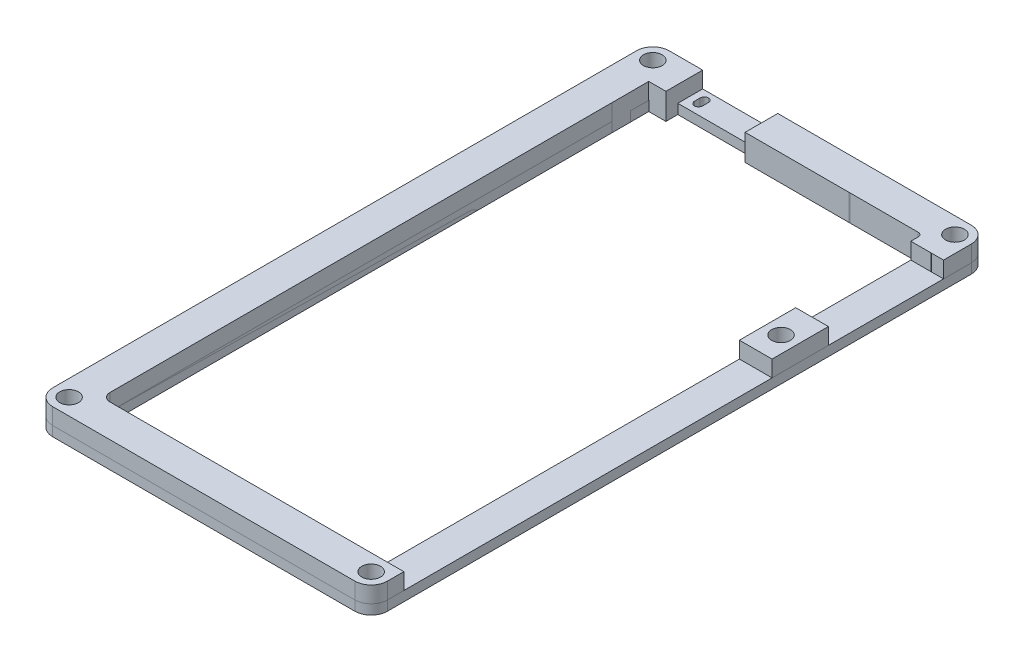
from build123d import *

# Parameters (mm, degrees)
A_MODIFY_R     = 1.15
TOP_A_DEPTH    = 3.2
TOP_A_2_DEPTH  = 3.2
TOP_A_3_DEPTH  = 3.2
C_MODIFY_R     = 1.15
C_MODIFY_W     = 32.999664857
C_MODIFY_H     = 68.457402291
BOTTOM_C_DEPTH = 1.2


with BuildPart() as part:
    # A-modify → top-A (new body)
    with BuildSketch(Plane(origin=(0, 0, 0), x_dir=(1, 0, 0), z_dir=(0, 1, 0))):
        with BuildLine():
            Line((0, 1.0025), (0, 62.4975))
            ThreePointArc((0, 62.4975), (-0.001767767, 62.501767767), (0.0025, 62.5))
            Line((0.0025, 62.5), (-0.0025, 67))
            Line((-0.0025, 67), (2.0975, 67))
            ThreePointArc((2.0975, 67), (2.098232233, 67.001767767), (2.1, 67.0025))
            Line((2.1, 67.0025), (2.1, 71.5))
            Line((2.1, 71.5), (-1.9975, 71.5))
            ThreePointArc((-1.9975, 71.5), (-1.998232233, 71.498232233), (-2, 71.4975))
            ThreePointArc((-2, 71.4975), (-2.001767194, 71.49823166), (-2.002499999, 71.49999838))
            ThreePointArc((-2.002499999, 71.49999838), (-3.4142, 70.9142), (-3.99999838, 69.502499999))
            ThreePointArc((-3.99999838, 69.502499999), (-3.9975, 69.49999919), (-4, 69.4975))
            Line((-4, 69.4975), (-4, -1.9975))
            ThreePointArc((-4, -1.9975), (-3.9975, -1.99999919), (-3.99999838, -2.002499999))
            ThreePointArc((-3.99999838, -2.002499999), (-3.4142, -3.4142), (-2.002499999, -3.99999838))
            ThreePointArc((-2.002499999, -3.99999838), (-1.99999919, -3.9975), (-1.9975, -4))
            Line((-1.9975, -4), (34.9975, -4))
            ThreePointArc((34.9975, -4), (34.99999919, -3.9975), (35.002499999, -3.99999838))
            ThreePointArc((35.002499999, -3.99999838), (36.4142, -3.4142), (36.99999838, -2.002499999))
            ThreePointArc((36.99999838, -2.002499999), (36.99823166, -2.001767194), (36.9975, -2))
            ThreePointArc((36.9975, -2), (36.998232233, -1.998232233), (37, -1.9975))
            Line((37, -1.9975), (37, 0))
            Line((37, 0), (1.0025, 0))
            ThreePointArc((1.0025, 0), (0.999998409, -0.002499999), (0.997500002, 3.183e-06))
            ThreePointArc((0.997500002, 3.183e-06), (0.2929, 0.2929), (3.183e-06, 0.997500002))
            ThreePointArc((3.183e-06, 0.997500002), (-0.002499999, 0.999998409), (0, 1.0025))
        make_face()
        with Locations((-2, -2)):
            Circle(A_MODIFY_R, mode=Mode.SUBTRACT)
        with Locations((35, -2)):
            Circle(A_MODIFY_R, mode=Mode.SUBTRACT)
        with Locations((-2, 69.5)):
            Circle(A_MODIFY_R, mode=Mode.SUBTRACT)
    extrude(amount=TOP_A_DEPTH)


with BuildPart() as body_2:
    # A-modify → top-A 2 (new body)
    with BuildSketch(Plane(origin=(0, 0, 0), x_dir=(1, 0, 0), z_dir=(0, 1, 0))):
        with BuildLine():
            Line((32.999990591, 66.9975), (32.999999984, 66.102483207))
            ThreePointArc((32.999999984, 66.102483207), (33.002500011, 66.09998322), (33.000000011, 66.097483207))
            Line((33.000000011, 66.097483207), (35.5, 66.0975))
            ThreePointArc((35.5, 66.0975), (35.498233345, 66.101768878), (35.502499998, 66.099996857))
            Line((35.502499996, 66.099996857), (37, 66.1))
            Line((37, 66.1), (37, 69.4975))
            ThreePointArc((37, 69.4975), (36.9975, 69.49999919), (36.99999838, 69.502499999))
            ThreePointArc((36.99999838, 69.502499999), (36.4142, 70.9142), (35.002499999, 71.49999838))
            ThreePointArc((35.002499999, 71.49999838), (34.99999919, 71.4975), (34.9975, 71.5))
            Line((34.9975, 71.5), (11.3, 71.5))
            Line((11.3, 71.5), (11.3, 67.4975))
            Line((11.3, 67.4975), (24.02849934, 67.4975))
            ThreePointArc((24.02849934, 67.4975), (24.077184455, 67.499342357), (24.125900001, 67.499998349))
            ThreePointArc((24.125900001, 67.499998349), (24.128399175, 67.5025), (24.1309, 67.5))
            Line((24.1309, 67.5), (32.4975, 67.5))
            ThreePointArc((32.4975, 67.5), (32.500003177, 67.502499998), (32.502499992, 67.499993645))
            ThreePointArc((32.502499992, 67.499993645), (32.853543901, 67.353546664), (32.999984257, 67.002499992))
            ThreePointArc((32.999984257, 67.002499992), (33.002490563, 67.000003167), (32.999990591, 66.9975))
        make_face()
        with Locations((35, 69.5)):
            Circle(A_MODIFY_R, mode=Mode.SUBTRACT)
    extrude(amount=TOP_A_2_DEPTH)


with BuildPart() as body_3:
    # A-modify → top-A 3 (new body)
    with BuildSketch(Plane(origin=(0, 0, 0), x_dir=(1, 0, 0), z_dir=(0, 1, 0))):
        with BuildLine():
            Line((37, 52), (35.502499996, 52.000003143))
            ThreePointArc((35.502499998, 52.000003143), (35.501768878, 51.998233345), (35.5, 51.9975))
            Line((35.5, 51.9975), (33, 51.997516793))
            Line((33, 51.997516793), (32.999953663, 45.100016793))
            Line((32.999953663, 45.100016793), (33.002453663, 45.100016776))
            Line((33.002453663, 45.100016793), (37, 45.099989924))
            Line((37, 45.099989924), (37, 52))
        make_face()
        with Locations((35, 48.2)):
            Circle(A_MODIFY_R, mode=Mode.SUBTRACT)
    extrude(amount=TOP_A_3_DEPTH)


with BuildPart() as body_4:
    # c-modify → bottom-C (new body)
    with BuildSketch(Plane(origin=(0, 0, 0), x_dir=(1, 0, 0), z_dir=(0, 1, 0))):
        with BuildLine():
            Line((-4, 69.4975), (-4, -1.9975))
            ThreePointArc((-4, -1.9975), (-3.998232233, -1.998232233), (-3.9975, -2))
            ThreePointArc((-3.9975, -2), (-3.99823166, -2.001767194), (-3.99999838, -2.002499999))
            ThreePointArc((-3.99999838, -2.002499999), (-3.4142, -3.4142), (-2.002499999, -3.99999838))
            ThreePointArc((-2.002499999, -3.99999838), (-2.001767194, -3.99823166), (-2, -3.9975))
            ThreePointArc((-2, -3.9975), (-1.998232233, -3.998232233), (-1.9975, -4))
            Line((-1.9975, -4), (34.9975, -4))
            ThreePointArc((34.9975, -4), (34.998232233, -3.998232233), (35, -3.9975))
            ThreePointArc((35, -3.9975), (35.001767194, -3.99823166), (35.002499999, -3.99999838))
            ThreePointArc((35.002499999, -3.99999838), (36.4142, -3.4142), (36.99999838, -2.002499999))
            ThreePointArc((36.99999838, -2.002499999), (36.99823166, -2.001767194), (36.9975, -2))
            ThreePointArc((36.9975, -2), (36.998232233, -1.998232233), (37, -1.9975))
            Line((37, -1.9975), (37, 69.4975))
            ThreePointArc((37, 69.4975), (36.998232233, 69.498232233), (36.9975, 69.5))
            ThreePointArc((36.9975, 69.5), (36.99823166, 69.501767194), (36.99999838, 69.502499999))
            ThreePointArc((36.99999838, 69.502499999), (36.4142, 70.9142), (35.002499999, 71.49999838))
            ThreePointArc((35.002499999, 71.49999838), (35.001767194, 71.49823166), (35, 71.4975))
            ThreePointArc((35, 71.4975), (34.998232233, 71.498232233), (34.9975, 71.5))
            Line((34.9975, 71.5), (-1.9975, 71.5))
            ThreePointArc((-1.9975, 71.5), (-1.998232233, 71.498232233), (-2, 71.4975))
            ThreePointArc((-2, 71.4975), (-2.001767194, 71.49823166), (-2.002499999, 71.49999838))
            ThreePointArc((-2.002499999, 71.49999838), (-3.4142, 70.9142), (-3.99999838, 69.502499999))
            ThreePointArc((-3.99999838, 69.502499999), (-3.99823166, 69.501767194), (-3.9975, 69.5))
            ThreePointArc((-3.9975, 69.5), (-3.998232233, 69.498232233), (-4, 69.4975))
        make_face()
        with Locations((-2, -2)):
            Circle(C_MODIFY_R, mode=Mode.SUBTRACT)
        with Locations((35, -2)):
            Circle(C_MODIFY_R, mode=Mode.SUBTRACT)
        with Locations((16.499832428, 34.228701146)):
            Rectangle(C_MODIFY_W, C_MODIFY_H, mode=Mode.SUBTRACT)
        with Locations((-2, 69.5)):
            Circle(C_MODIFY_R, mode=Mode.SUBTRACT)
        with BuildLine():
            ThreePointArc((2.8975, 69.7), (2.898232233, 69.701767767), (2.9, 69.7025))
            Line((2.9, 69.7025), (2.9, 70.3975))
            ThreePointArc((2.9, 70.3975), (2.898232233, 70.398232233), (2.8975, 70.4))
            ThreePointArc((2.8975, 70.4), (2.898234465, 70.401769996), (2.900006308, 70.402499992))
            ThreePointArc((2.900006308, 70.402499992), (3.04645, 70.75355), (3.397500008, 70.899993692))
            ThreePointArc((3.397500008, 70.899993692), (3.398230004, 70.901765535), (3.4, 70.9025))
            ThreePointArc((3.4, 70.9025), (3.401769996, 70.901765535), (3.402499992, 70.899993692))
            ThreePointArc((3.402499992, 70.899993692), (3.75355, 70.75355), (3.899993692, 70.402499992))
            ThreePointArc((3.899993692, 70.402499992), (3.901765535, 70.401769996), (3.9025, 70.4))
            ThreePointArc((3.9025, 70.4), (3.901767767, 70.398232233), (3.9, 70.3975))
            Line((3.9, 70.3975), (3.9, 69.7025))
            ThreePointArc((3.9, 69.7025), (3.901767767, 69.701767767), (3.9025, 69.7))
            ThreePointArc((3.9025, 69.7), (3.901765535, 69.698230004), (3.899993692, 69.697500008))
            ThreePointArc((3.899993692, 69.697500008), (3.75355, 69.34645), (3.402499992, 69.200006308))
            ThreePointArc((3.402499992, 69.200006308), (3.401769996, 69.198234465), (3.4, 69.1975))
            ThreePointArc((3.4, 69.1975), (3.398230004, 69.198234465), (3.397500008, 69.200006308))
            ThreePointArc((3.397500008, 69.200006308), (3.04645, 69.34645), (2.900006308, 69.697500008))
            ThreePointArc((2.900006308, 69.697500008), (2.898234465, 69.698230004), (2.8975, 69.7))
        make_face(mode=Mode.SUBTRACT)
        with BuildLine():
            ThreePointArc((9.4975, 69.7), (9.498232233, 69.701767767), (9.5, 69.7025))
            Line((9.5, 69.7025), (9.5, 70.3975))
            ThreePointArc((9.5, 70.3975), (9.498232233, 70.398232233), (9.4975, 70.4))
            ThreePointArc((9.4975, 70.4), (9.498234465, 70.401769996), (9.500006308, 70.402499992))
            ThreePointArc((9.500006308, 70.402499992), (9.64645, 70.75355), (9.997500008, 70.899993692))
            ThreePointArc((9.997500008, 70.899993692), (9.998230004, 70.901765535), (10, 70.9025))
            ThreePointArc((10, 70.9025), (10.001769996, 70.901765535), (10.002499992, 70.899993692))
            ThreePointArc((10.002499992, 70.899993692), (10.35355, 70.75355), (10.499993692, 70.402499992))
            ThreePointArc((10.499993692, 70.402499992), (10.501765535, 70.401769996), (10.5025, 70.4))
            ThreePointArc((10.5025, 70.4), (10.501767767, 70.398232233), (10.5, 70.3975))
            Line((10.5, 70.3975), (10.5, 69.7025))
            ThreePointArc((10.5, 69.7025), (10.501767767, 69.701767767), (10.5025, 69.7))
            ThreePointArc((10.5025, 69.7), (10.501765535, 69.698230004), (10.499993692, 69.697500008))
            ThreePointArc((10.499993692, 69.697500008), (10.35355, 69.34645), (10.002499992, 69.200006308))
            ThreePointArc((10.002499992, 69.200006308), (10.001769996, 69.198234465), (10, 69.1975))
            ThreePointArc((10, 69.1975), (9.998230004, 69.198234465), (9.997500008, 69.200006308))
            ThreePointArc((9.997500008, 69.200006308), (9.64645, 69.34645), (9.500006308, 69.697500008))
            ThreePointArc((9.500006308, 69.697500008), (9.498234465, 69.698230004), (9.4975, 69.7))
        make_face(mode=Mode.SUBTRACT)
        with Locations((35, 48.2)):
            Circle(C_MODIFY_R, mode=Mode.SUBTRACT)
        with Locations((35, 69.5)):
            Circle(C_MODIFY_R, mode=Mode.SUBTRACT)
    extrude(amount=BOTTOM_C_DEPTH)


solid = Compound([part.part, body_2.part, body_3.part, body_4.part])
